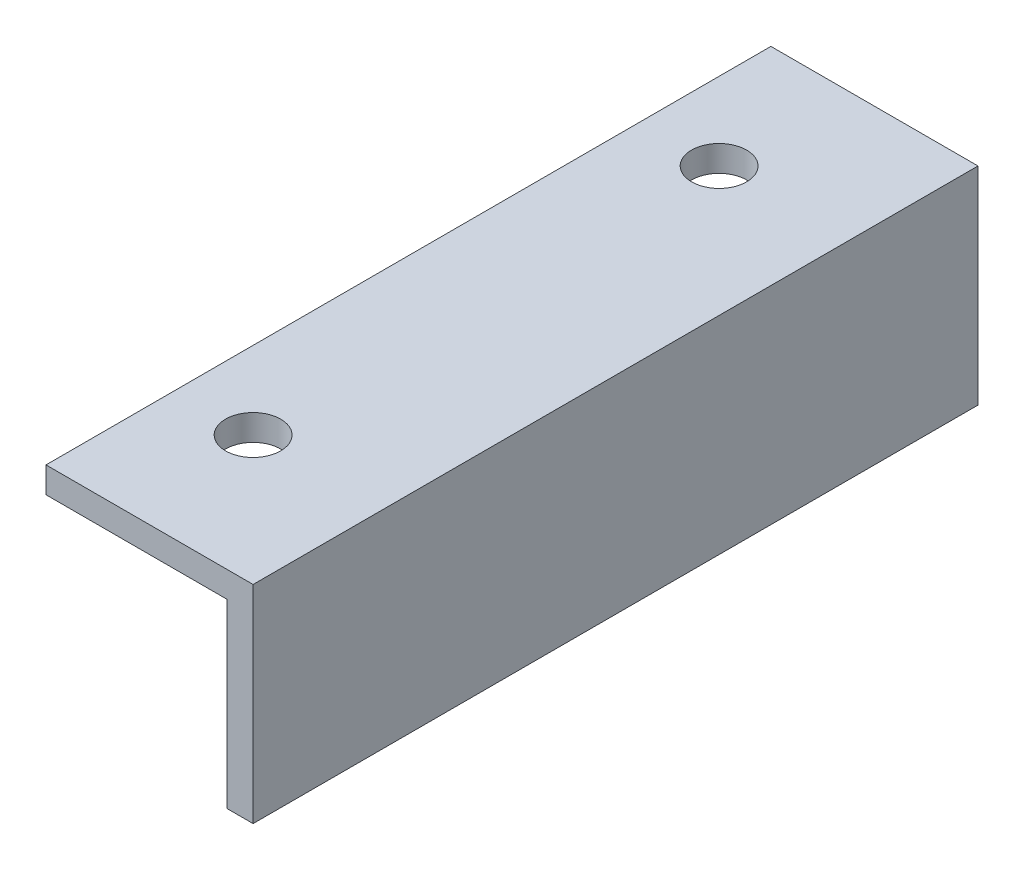
from build123d import *

# Parameters (mm, degrees)
BOSS_EXTRUDE1_DEPTH = 88.9
SKETCH2_R           = 3.3782
CUT_EXTRUDE1_DEPTH  = 96.882897328


with BuildPart() as part:
    # Sketch1 → Boss-Extrude1 (new body)
    with BuildSketch(Plane.XY):
        Polygon((0, 0), (0, 25.4), (-25.4, 25.4), (-25.4, 22.225), (-3.175, 22.225), (-3.175, 0), align=None)
    extrude(amount=BOSS_EXTRUDE1_DEPTH)

    # Sketch2 → Cut-Extrude1 (cut, through all)
    with BuildSketch(Plane(origin=(0, 25.4, 0), x_dir=(1, 0, 0), z_dir=(0, 1, 0))):
        with Locations((-15.875, -15.875)):
            Circle(SKETCH2_R)
        with Locations((-15.875, -73.025)):
            Circle(SKETCH2_R)
    extrude(amount=-CUT_EXTRUDE1_DEPTH, mode=Mode.SUBTRACT)


solid = part.part
